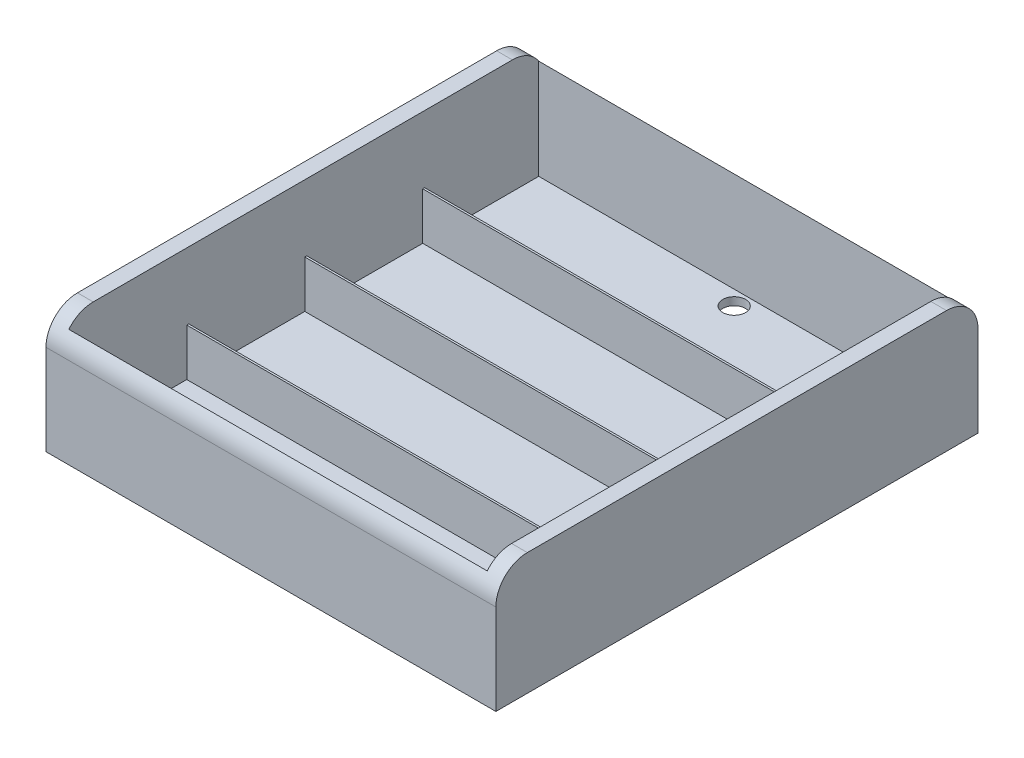
from build123d import *

# Parameters (mm, degrees)
SKETCH1_W                  = 57.2
SKETCH1_H                  = 61.3
BOSS_EXTRUDE1_DEPTH        = 15.5
F_2_9_2_9_DIAMETER_HOLE1_D = 2.9
SKETCH4_W                  = 53.2
SKETCH4_H                  = 59.75
CUT_EXTRUDE1_DEPTH         = 14.5
FILLET4_R                  = 4
SKETCH5_W                  = 53.2
SKETCH5_H                  = 0.25
BOSS_EXTRUDE2_DEPTH        = 6
LPATTERN1_COUNT            = 3
LPATTERN1_PITCH            = 15


with BuildPart() as part:
    # Sketch1 → Boss-Extrude1 (new body)
    with BuildSketch(Plane(origin=(0, 0, 0), x_dir=(1, 0, 0), z_dir=(0, 1, 0))):
        with Locations((28.6, 30.65)):
            Rectangle(SKETCH1_W, SKETCH1_H)
    extrude(amount=BOSS_EXTRUDE1_DEPTH)

    # Ø2.9 (2.9) Diameter Hole1 (through all)
    with Locations(Plane(origin=(0, 15.5, 0), x_dir=(-1, 0, 0), z_dir=(0, 1, 0))):
        with Locations((-28.7, -58.8), (-28.7, -3.7)):
            Hole(F_2_9_2_9_DIAMETER_HOLE1_D / 2)

    # Sketch4 → Cut-Extrude1 (cut)
    with BuildSketch(Plane(origin=(0, 15.5, 0), x_dir=(1, 0, 0), z_dir=(0, 1, 0))):
        with Locations((28.6, 30.775)):
            Rectangle(SKETCH4_W, SKETCH4_H)
    extrude(amount=-CUT_EXTRUDE1_DEPTH, mode=Mode.SUBTRACT)

    # Fillet4
    # the kernel refuses this fillet: 4 mm, written as the material it takes off along each edge
    with BuildSketch(Plane(origin=(-10, 15.5, 0), x_dir=(0, -1, 0), z_dir=(1, 0, 0))) as fillet4_piece_1:
        with BuildLine():
            CenterArc((FILLET4_R, FILLET4_R), FILLET4_R, 180, 90)
            Line((0, FILLET4_R), (0, 0))
            Line((0, 0), (FILLET4_R, 0))
        make_face()
    extrude(amount=77.2, mode=Mode.SUBTRACT)
    with BuildSketch(Plane(origin=(67.2, 15.5, -61.3), x_dir=(0, 0, 1), z_dir=(-1, 0, 0))) as fillet4_piece_2:
        with BuildLine():
            CenterArc((FILLET4_R, -FILLET4_R), FILLET4_R, 90, 90)
            Line((0, -FILLET4_R), (0, 0))
            Line((0, 0), (FILLET4_R, 0))
        make_face()
    extrude(amount=77.2, mode=Mode.SUBTRACT)

    # Sketch5 → Boss-Extrude2 (add)
    with BuildSketch(Plane(origin=(0, 1, 0), x_dir=(1, 0, 0), z_dir=(0, 1, 0))):
        with Locations((28.6, 16.025)):
            Rectangle(SKETCH5_W, SKETCH5_H)
    boss_extrude2 = extrude(amount=BOSS_EXTRUDE2_DEPTH)

    # LPattern1: Boss-Extrude2 ×3
    with Locations(*[(0, 0, -i * LPATTERN1_PITCH) for i in range(1, LPATTERN1_COUNT)]):
        add(boss_extrude2)


solid = part.part
